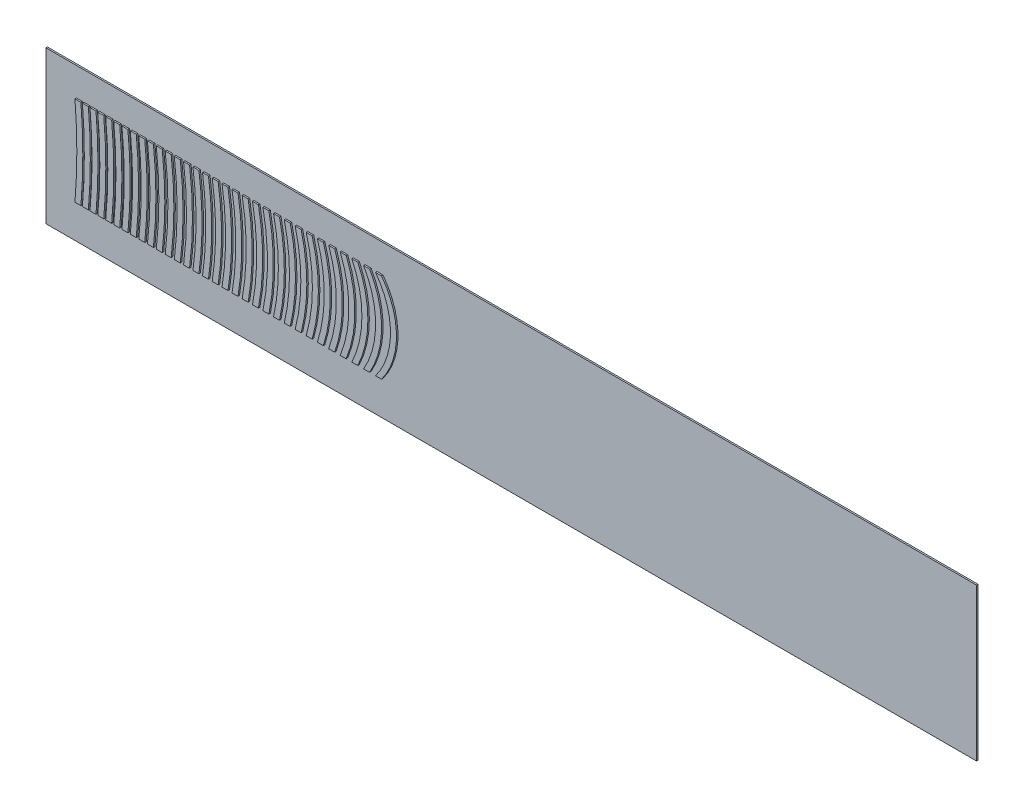
from build123d import *

# Parameters (mm, degrees)
BOSS_EXTRUDE1_DEPTH = 25.4
SKETCH2_W           = 15842.55357726
SKETCH2_H           = 2594.096375424
BOSS_EXTRUDE2_DEPTH = 25.4
LPATTERN1_DEPTH     = 25.4


# Read off the part's stored shape, not the designer's step: LPattern1
with BuildPart() as part:
    # Sketch1 → Boss-Extrude1 (new body)
    with BuildSketch(Plane.XY):
        with BuildLine():
            Line((0, 762), (101.6, 762))
            ThreePointArc((101.6, 762), (133.405313757, 0), (101.6, -762))
            Line((101.6, -762), (0, -762))
            ThreePointArc((0, -762), (31.805313757, 0), (0, 762))
        make_face()
    extrude(amount=BOSS_EXTRUDE1_DEPTH)

    # Sketch2 → Boss-Extrude2 (add)
    with BuildSketch(Plane(origin=(0, 0, 0), x_dir=(-1, 0, 0), z_dir=(0, 0, -1))):
        with Locations((-7402.927555246, -54.762680467)):
            Rectangle(SKETCH2_W, SKETCH2_H)
    extrude(amount=BOSS_EXTRUDE2_DEPTH)

    # LPattern1 outline → LPattern1 (add)
    with BuildSketch(Plane.XY):
        with BuildLine():
            Line((127, -762), (228.6, -762))
            ThreePointArc((228.6, -762), (261.317346725, 0), (228.6, 762))
            Line((228.6, 762), (127, 762))
            ThreePointArc((127, 762), (159.717346725, 0), (127, -762))
        make_face()
        with BuildLine():
            Line((256.54, -762), (358.14, -762))
            ThreePointArc((358.14, -762), (391.823335287, 0), (358.14, 762))
            Line((358.14, 762), (256.54, 762))
            ThreePointArc((256.54, 762), (290.223335287, 0), (256.54, -762))
        make_face()
        with BuildLine():
            Line((388.62, -762), (490.22, -762))
            ThreePointArc((490.22, -762), (524.928223621, 0), (490.22, 762))
            Line((490.22, 762), (388.62, 762))
            ThreePointArc((388.62, 762), (423.328223621, 0), (388.62, -762))
        make_face()
        with BuildLine():
            Line((523.24, -762), (624.84, -762))
            ThreePointArc((624.84, -762), (660.637580386, 0), (624.84, 762))
            Line((624.84, 762), (523.24, 762))
            ThreePointArc((523.24, 762), (559.037580386, 0), (523.24, -762))
        make_face()
        with BuildLine():
            Line((660.4, -762), (762, -762))
            ThreePointArc((762, -762), (798.957700765, 0), (762, 762))
            Line((762, 762), (660.4, 762))
            ThreePointArc((660.4, 762), (697.357700765, 0), (660.4, -762))
        make_face()
        with BuildLine():
            Line((800.1, -762), (901.7, -762))
            ThreePointArc((901.7, -762), (939.895729248, 0), (901.7, 762))
            Line((901.7, 762), (800.1, 762))
            ThreePointArc((800.1, 762), (838.295729248, 0), (800.1, -762))
        make_face()
        with BuildLine():
            Line((942.34, -762), (1043.94, -762))
            ThreePointArc((1043.94, -762), (1083.459808257, 0), (1043.94, 762))
            Line((1043.94, 762), (942.34, 762))
            ThreePointArc((942.34, 762), (981.859808257, 0), (942.34, -762))
        make_face()
        with BuildLine():
            Line((1087.12, -762), (1188.72, -762))
            ThreePointArc((1188.72, -762), (1229.659259206, 0), (1188.72, 762))
            Line((1188.72, 762), (1087.12, 762))
            ThreePointArc((1087.12, 762), (1128.059259206, 0), (1087.12, -762))
        make_face()
        with BuildLine():
            Line((1234.44, -762), (1336.04, -762))
            ThreePointArc((1336.04, -762), (1378.504804581, 0), (1336.04, 762))
            Line((1336.04, 762), (1234.44, 762))
            ThreePointArc((1234.44, 762), (1276.904804581, 0), (1234.44, -762))
        make_face()
        with BuildLine():
            Line((1384.3, -762), (1485.9, -762))
            ThreePointArc((1485.9, -762), (1530.008842366, 0), (1485.9, 762))
            Line((1485.9, 762), (1384.3, 762))
            ThreePointArc((1384.3, 762), (1428.408842366, 0), (1384.3, -762))
        make_face()
        with BuildLine():
            Line((1536.7, -762), (1638.3, -762))
            ThreePointArc((1638.3, -762), (1684.185787837, 0), (1638.3, 762))
            Line((1638.3, 762), (1536.7, 762))
            ThreePointArc((1536.7, 762), (1582.585787837, 0), (1536.7, -762))
        make_face()
        with BuildLine():
            Line((1691.64, -762), (1793.24, -762))
            ThreePointArc((1793.24, -762), (1841.052502906, 0), (1793.24, 762))
            Line((1793.24, 762), (1691.64, 762))
            ThreePointArc((1691.64, 762), (1739.452502906, 0), (1691.64, -762))
        make_face()
        with BuildLine():
            Line((1849.12, -762), (1950.72, -762))
            ThreePointArc((1950.72, -762), (2000.628840496, 0), (1950.72, 762))
            Line((1950.72, 762), (1849.12, 762))
            ThreePointArc((1849.12, 762), (1899.028840496, 0), (1849.12, -762))
        make_face()
        with BuildLine():
            Line((2009.14, -762), (2110.74, -762))
            ThreePointArc((2110.74, -762), (2162.938341703, 0), (2110.74, 762))
            Line((2110.74, 762), (2009.14, 762))
            ThreePointArc((2009.14, 762), (2061.338341703, 0), (2009.14, -762))
        make_face()
        with BuildLine():
            Line((2171.7, -762), (2273.3, -762))
            ThreePointArc((2273.3, -762), (2328.00913853, 0), (2273.3, 762))
            Line((2273.3, 762), (2171.7, 762))
            ThreePointArc((2171.7, 762), (2226.40913853, 0), (2171.7, -762))
        make_face()
        with BuildLine():
            Line((2336.8, -762), (2438.4, -762))
            ThreePointArc((2438.4, -762), (2495.875136946, 0), (2438.4, 762))
            Line((2438.4, 762), (2336.8, 762))
            ThreePointArc((2336.8, 762), (2394.275136946, 0), (2336.8, -762))
        make_face()
        with BuildLine():
            Line((2504.44, -762), (2606.04, -762))
            ThreePointArc((2606.04, -762), (2666.577588019, 0), (2606.04, 762))
            Line((2606.04, 762), (2504.44, 762))
            ThreePointArc((2504.44, 762), (2564.977588019, 0), (2504.44, -762))
        make_face()
        with BuildLine():
            Line((2674.62, -762), (2776.22, -762))
            ThreePointArc((2776.22, -762), (2840.167205278, 0), (2776.22, 762))
            Line((2776.22, 762), (2674.62, 762))
            ThreePointArc((2674.62, 762), (2738.567205278, 0), (2674.62, -762))
        make_face()
        with BuildLine():
            Line((2847.34, -762), (2948.94, -762))
            ThreePointArc((2948.94, -762), (3016.707065207, 0), (2948.94, 762))
            Line((2948.94, 762), (2847.34, 762))
            ThreePointArc((2847.34, 762), (2915.107065207, 0), (2847.34, -762))
        make_face()
        with BuildLine():
            Line((3022.6, -762), (3124.2, -762))
            ThreePointArc((3124.2, -762), (3196.276654043, 0), (3124.2, 762))
            Line((3124.2, 762), (3022.6, 762))
            ThreePointArc((3022.6, 762), (3094.676654043, 0), (3022.6, -762))
        make_face()
        with BuildLine():
            Line((3200.4, -762), (3302, -762))
            ThreePointArc((3302, -762), (3378.977631998, 0), (3302, 762))
            Line((3302, 762), (3200.4, 762))
            ThreePointArc((3200.4, 762), (3277.377631998, 0), (3200.4, -762))
        make_face()
        with BuildLine():
            Line((3380.74, -762), (3482.34, -762))
            ThreePointArc((3482.34, -762), (3564.942239881, 0), (3482.34, 762))
            Line((3482.34, 762), (3380.74, 762))
            ThreePointArc((3380.74, 762), (3463.342239881, 0), (3380.74, -762))
        make_face()
        with BuildLine():
            Line((3563.62, -762), (3665.22, -762))
            ThreePointArc((3665.22, -762), (3754.345897269, 0), (3665.22, 762))
            Line((3665.22, 762), (3563.62, 762))
            ThreePointArc((3563.62, 762), (3652.745897269, 0), (3563.62, -762))
        make_face()
        with BuildLine():
            Line((3749.04, -762), (3850.64, -762))
            ThreePointArc((3850.64, -762), (3947.42669019, 0), (3850.64, 762))
            Line((3850.64, 762), (3749.04, 762))
            ThreePointArc((3749.04, 762), (3845.82669019, 0), (3749.04, -762))
        make_face()
        with BuildLine():
            Line((3937, -762), (4038.6, -762))
            ThreePointArc((4038.6, -762), (4144.516667958, 0), (4038.6, 762))
            Line((4038.6, 762), (3937, 762))
            ThreePointArc((3937, 762), (4042.916667958, 0), (3937, -762))
        make_face()
        with BuildLine():
            Line((4127.5, -762), (4229.1, -762))
            ThreePointArc((4229.1, -762), (4346.094428401, 0), (4229.1, 762))
            Line((4229.1, 762), (4127.5, 762))
            ThreePointArc((4127.5, 762), (4244.494428401, 0), (4127.5, -762))
        make_face()
        with BuildLine():
            Line((4320.54, -762), (4422.14, -762))
            ThreePointArc((4422.14, -762), (4552.878530943, 0), (4422.14, 762))
            Line((4422.14, 762), (4320.54, 762))
            ThreePointArc((4320.54, 762), (4451.278530943, 0), (4320.54, -762))
        make_face()
        with BuildLine():
            Line((4516.12, -762), (4617.72, -762))
            ThreePointArc((4617.72, -762), (4766.005584278, 0), (4617.72, 762))
            Line((4617.72, 762), (4516.12, 762))
            ThreePointArc((4516.12, 762), (4664.405584278, 0), (4516.12, -762))
        make_face()
        with BuildLine():
            Line((4714.24, -762), (4815.84, -762))
            ThreePointArc((4815.84, -762), (4987.402948634, 0), (4815.84, 762))
            Line((4815.84, 762), (4714.24, 762))
            ThreePointArc((4714.24, 762), (4885.802948634, 0), (4714.24, -762))
        make_face()
        with BuildLine():
            Line((4914.9, -762), (5016.5, -762))
            ThreePointArc((5016.5, -762), (5220.677284633, 0), (5016.5, 762))
            Line((5016.5, 762), (4914.9, 762))
            ThreePointArc((4914.9, 762), (5119.077284633, 0), (4914.9, -762))
        make_face()
        with BuildLine():
            Line((5118.1, -762), (5219.7, -762))
            ThreePointArc((5219.7, -762), (5473.7, 0), (5219.7, 762))
            Line((5219.7, 762), (5118.1, 762))
            ThreePointArc((5118.1, 762), (5372.1, 0), (5118.1, -762))
        make_face()
    extrude(amount=LPATTERN1_DEPTH)


solid = part.part
